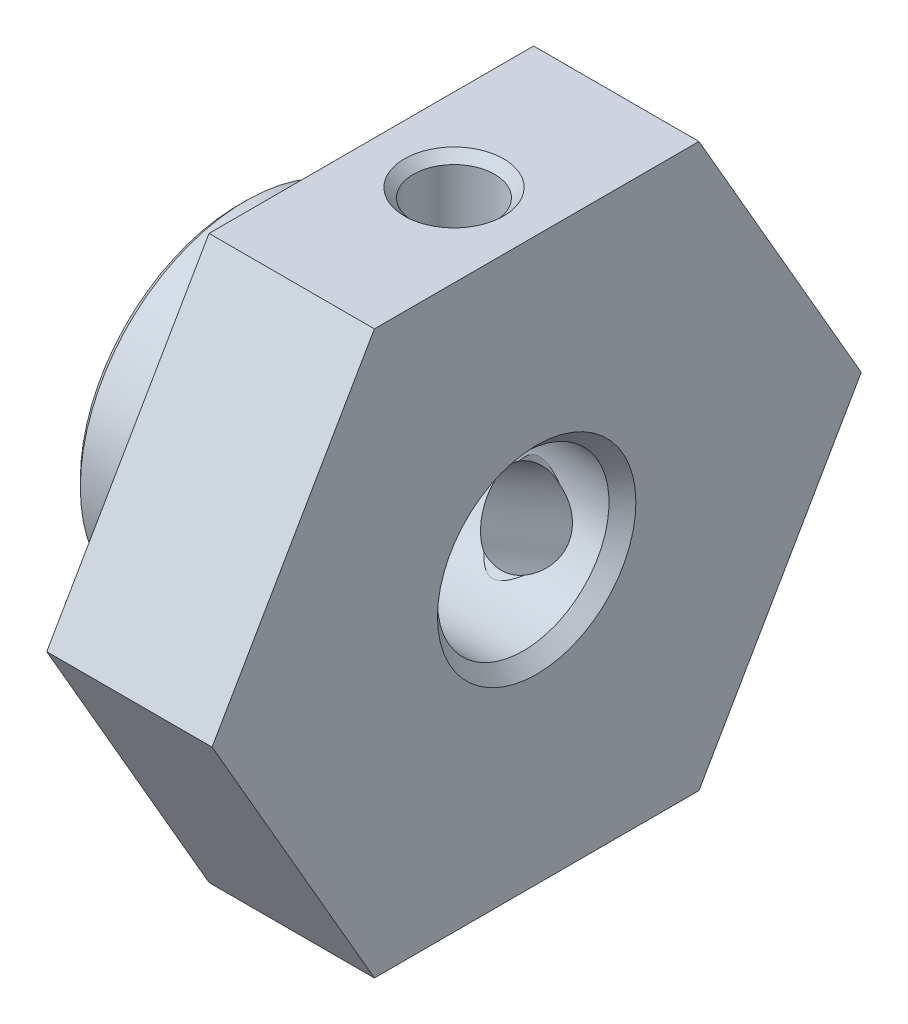
from build123d import *

# Parameters (mm, degrees)
SKETCH3_W          = 34
SKETCH3_H          = 34
CUT_EXTRUDE1_DEPTH = 9


with BuildPart() as part:
    # Sketch1 → Revolve1 (revolve)
    with BuildSketch(Plane.XY):
        Polygon((0, 0), (0, 4.8), (0.2, 5), (4, 5), (4, 10.2), (9, 10.2), (9, 0), align=None)
    revolve(axis=Axis((9, 0, 0), (-1, 0, 0)))

    # Sketch2 → Cut-Revolve1 (revolve, cut)
    with BuildSketch(Plane.XY):
        Polygon((0, 0), (0, 3), (0.406, 2.594), (8.594, 2.594), (9, 3), (9, 0), align=None)
    revolve(axis=Axis((9, 0, 0), (-1, 0, 0)), mode=Mode.SUBTRACT)

    # Sketch3 → Cut-Extrude1 (cut)
    with BuildSketch(Plane(origin=(0, 0, 0), x_dir=(0, 0, -1), z_dir=(1, 0, 0))):
        Rectangle(SKETCH3_W, SKETCH3_H)
        Polygon((-9.814954576, 0), (-4.907477288, -8.5), (4.907477288, -8.5), (9.814954576, 0), (4.907477288, 8.5), (-4.907477288, 8.5), align=None, mode=Mode.SUBTRACT)
    extrude(amount=CUT_EXTRUDE1_DEPTH, mode=Mode.SUBTRACT)

    # Sketch4 → Cut-Revolve2 (revolve, cut)
    with BuildSketch(Plane(origin=(6.5, 0, 0), x_dir=(0, 0, -1), z_dir=(1, 0, 0))):
        Polygon((0, 8.5), (1.5, 8.5), (1.2295, 8.2295), (1.2295, 2.3645), (1.5, 2.094), (0, 2.094), align=None)
    revolve(axis=Axis((6.5, 2.094, 0), (0, 1, 0)), mode=Mode.SUBTRACT)

    # Sketch5 → Cut-Revolve3 (revolve, cut)
    with BuildSketch(Plane(origin=(6.5, 0, 0), x_dir=(0, 0, -1), z_dir=(1, 0, 0))):
        Polygon((7.361215932, -4.25), (6.611215932, -5.549038106), (6.51220606, -5.179528234), (1.432967067, -2.247028234), (1.063457196, -2.346038106), (1.813457196, -1.047), align=None)
    revolve(axis=Axis((6.5, -1.047, -1.813457196), (0, -0.500000000000001, -0.866025403784438)), mode=Mode.SUBTRACT)


solid = part.part
